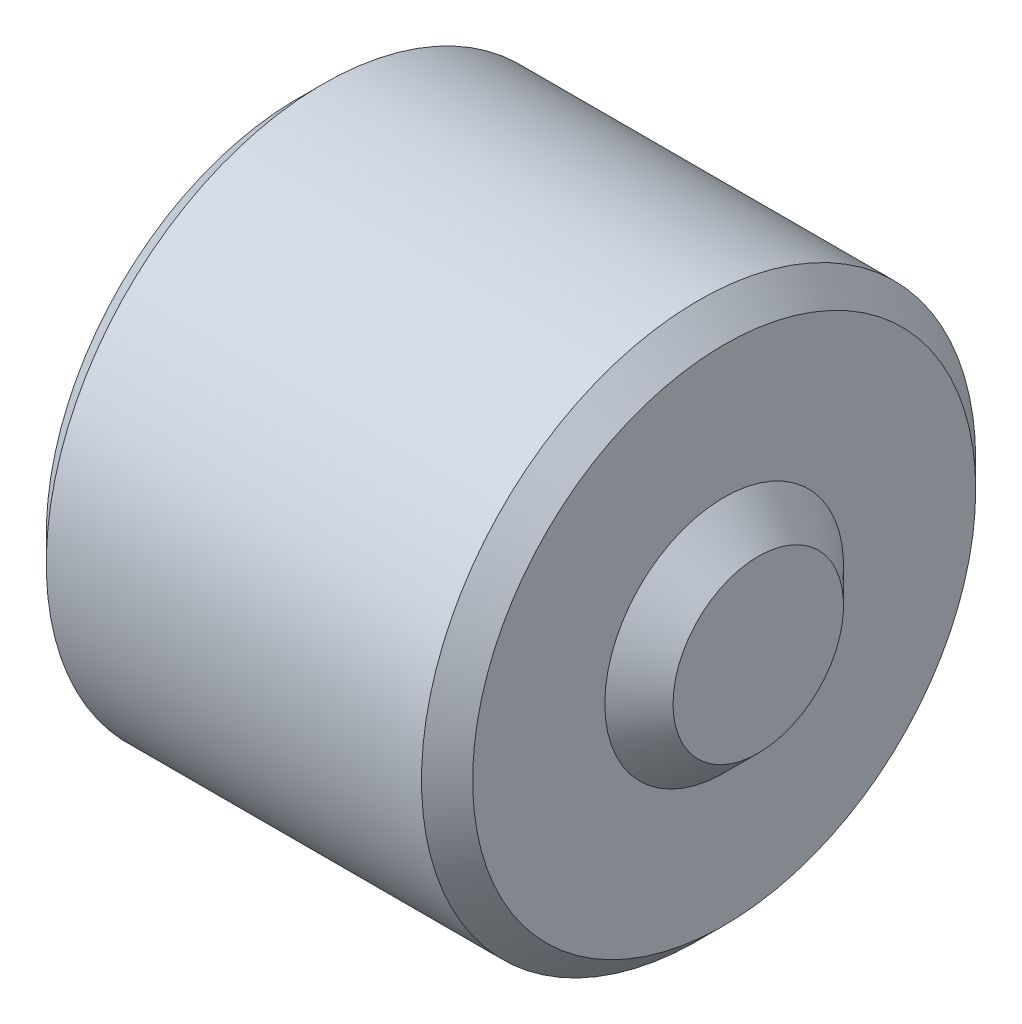
from build123d import *

# Parameters (mm, degrees)
SKETCH1_R           = 8.255
BOSS_EXTRUDE1_DEPTH = 12.7
SKETCH2_R           = 5.715
CUT_EXTRUDE1_DEPTH  = 10.16
CHAMFER1_SIZE       = 0.762


with BuildPart() as part:
    # Sketch1 → Boss-Extrude1 (new body)
    with BuildSketch(Plane(origin=(0, 0, 0), x_dir=(0, 0, -1), z_dir=(1, 0, 0))):
        Circle(SKETCH1_R)
    extrude(amount=-BOSS_EXTRUDE1_DEPTH)

    # Sketch2 → Cut-Extrude1 (cut)
    with BuildSketch(Plane.ZY.offset(12.7)):
        Circle(SKETCH2_R)
    extrude(amount=-CUT_EXTRUDE1_DEPTH, mode=Mode.SUBTRACT)

    # Chamfer1
    chamfer1_edges = [part.edges().sort_by_distance(p)[0] for p in [
        (-12.7, 0, 8.255),
        (0, 0, 8.255),
    ]]
    chamfer(chamfer1_edges, length=CHAMFER1_SIZE)

    # Sketch3 → Revolve1 (revolve)
    with BuildSketch(Plane(origin=(0, 0, 0), x_dir=(1, 0, 0), z_dir=(0, 1, 0))):
        Polygon((0, 0), (1.016, 0), (1.016, 2.54), (0, 3.556), align=None)
    revolve(axis=Axis((-11.938, 0, 0), (1, 0, 0)))


solid = part.part
